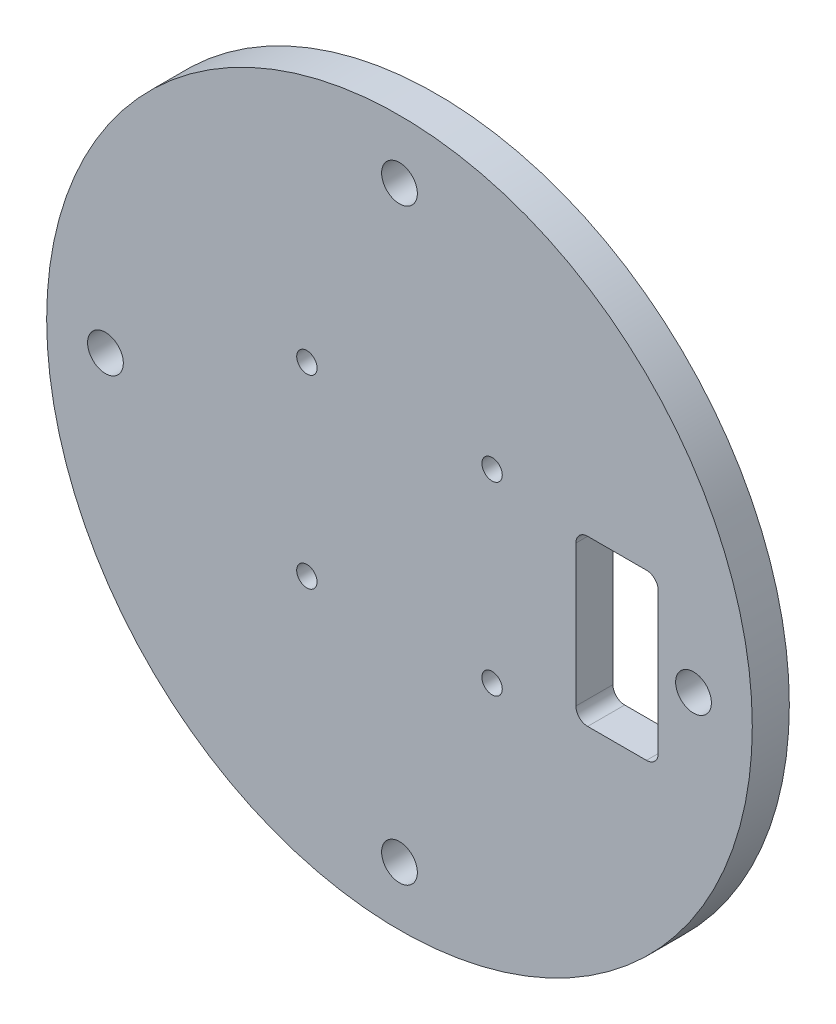
from build123d import *

# Parameters (mm, degrees)
SKETCH1_R               = 38.1
BOSS_EXTRUDE1_DEPTH     = 4
SKETCH2_R               = 1.1
CUT_EXTRUDE1_DEPTH      = 55.029806589
CUT_EXTRUDE2_DEPTH      = 55.029806589
CUT_EXTRUDE2_DEPTH_BACK = 55.029806589
SKETCH3_R               = 1.9304
CUT_EXTRUDE3_DEPTH      = 55.029806589
CUT_EXTRUDE3_DEPTH_BACK = 55.029806589


with BuildPart() as part:
    # Sketch1 → Boss-Extrude1 (new body)
    with BuildSketch(Plane.XY):
        Circle(SKETCH1_R)
    extrude(amount=BOSS_EXTRUDE1_DEPTH)

    # Sketch2 → Cut-Extrude1 (cut, through all)
    with BuildSketch(Plane.XY.offset(4)):
        with Locations((10, 10)):
            Circle(SKETCH2_R)
        with Locations((10, -10)):
            Circle(SKETCH2_R)
        with Locations((-10, -10)):
            Circle(SKETCH2_R)
        with Locations((-10, 10)):
            Circle(SKETCH2_R)
    extrude(amount=-CUT_EXTRUDE1_DEPTH, mode=Mode.SUBTRACT)

    # Sketch3 → Cut-Extrude2 (cut, two sides: drawn at the far end of the back side and taken through both)
    with BuildSketch(Plane.XY.offset(4).offset(-CUT_EXTRUDE2_DEPTH_BACK)):
        with Locations((0, -31.75)):
            Circle(SKETCH3_R)
        with Locations((-31.75, 0)):
            Circle(SKETCH3_R)
        with Locations((0, 31.75)):
            Circle(SKETCH3_R)
        with Locations((31.75, 0)):
            Circle(SKETCH3_R)
    extrude(amount=CUT_EXTRUDE2_DEPTH + CUT_EXTRUDE2_DEPTH_BACK, mode=Mode.SUBTRACT)

    # Sketch4 → Cut-Extrude3 (cut, two sides: drawn at the far end of the back side and taken through both)
    with BuildSketch(Plane.XY.offset(4).offset(-CUT_EXTRUDE3_DEPTH_BACK)):
        with BuildLine():
            Line((20.32, 8.89), (26.67, 8.89))
            ThreePointArc((26.67, 8.89), (27.568025612, 8.518025612), (27.94, 7.62))
            Line((27.94, 7.62), (27.94, -7.62))
            ThreePointArc((27.94, -7.62), (27.568025612, -8.518025612), (26.67, -8.89))
            Line((26.67, -8.89), (20.32, -8.89))
            ThreePointArc((20.32, -8.89), (19.421974388, -8.518025612), (19.05, -7.62))
            Line((19.05, -7.62), (19.05, 7.62))
            ThreePointArc((19.05, 7.62), (19.421974388, 8.518025612), (20.32, 8.89))
        make_face()
    extrude(amount=CUT_EXTRUDE3_DEPTH + CUT_EXTRUDE3_DEPTH_BACK, mode=Mode.SUBTRACT)


solid = part.part
